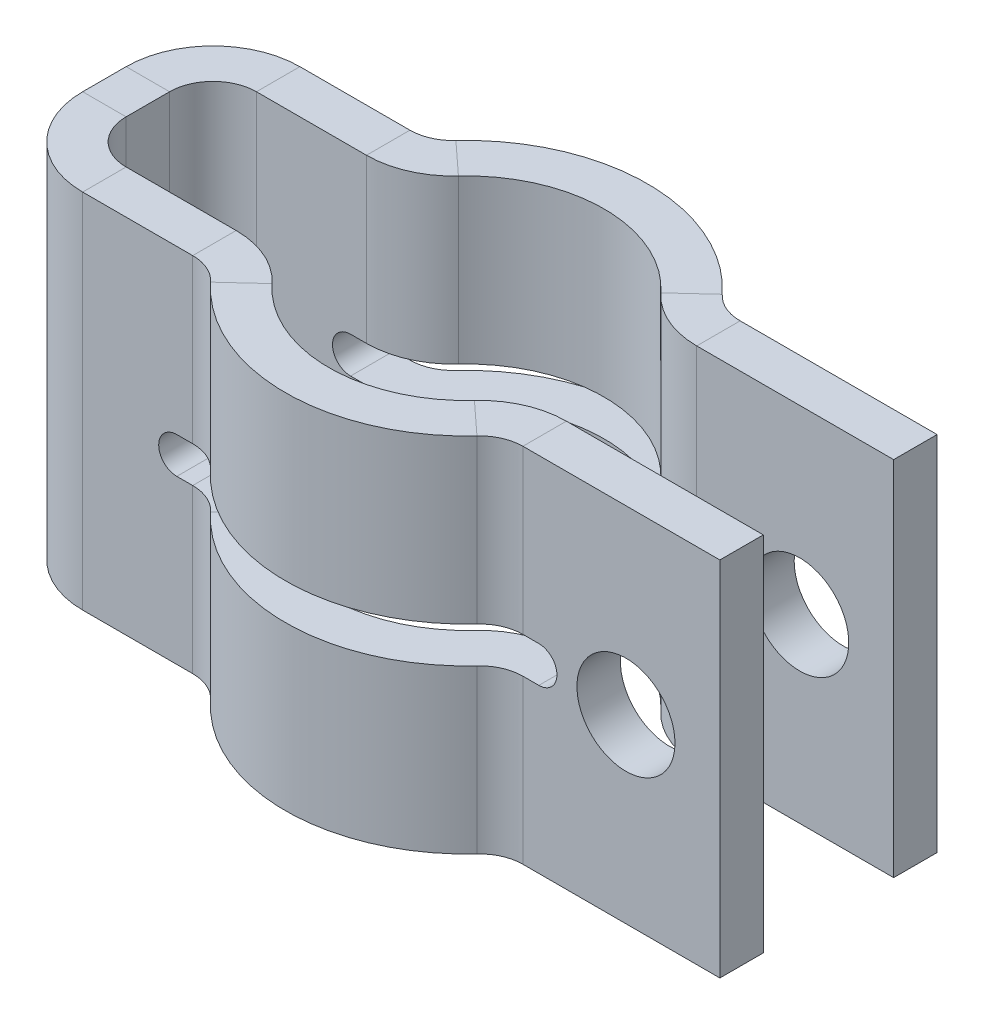
from build123d import *

# Parameters (mm, degrees)
BASE_FLANGE1_START      = -1.25
BASE_FLANGE1_DEPTH      = 2.5
SKETCH6_R               = 0.338529601
CUT_EXTRUDE1_DEPTH      = 4.436931771
CUT_EXTRUDE2_DEPTH      = 4.436931771
CUT_EXTRUDE2_DEPTH_BACK = 4.436931771


# Read off the part's stored shape, not the designer's step: Base-Flange1
with BuildPart() as part:
    # Base-Flange1 outline → Base-Flange1 (new body)
    with BuildSketch(Plane(origin=(0, 0, 0), x_dir=(1, 0, 0), z_dir=(0, 1, 0)).offset(BASE_FLANGE1_START)):
        with BuildLine():
            Line((1.140175425, 0.45), (2.5, 0.45))
            Line((2.5, 0.45), (2.5, 0.75))
            Line((2.5, 0.75), (1.140175425, 0.75))
            ThreePointArc((1.140175425, 0.75), (1.019692526, 0.775256718), (0.919496311, 0.846774194))
            ThreePointArc((0.919496311, 0.846774194), (0, 1.25), (-0.919496311, 0.846774194))
            ThreePointArc((-0.919496311, 0.846774194), (-1.019692526, 0.775256718), (-1.140175425, 0.75))
            Line((-1.140175425, 0.75), (-1.9, 0.75))
            ThreePointArc((-1.9, 0.75), (-2.324264069, 0.574264069), (-2.5, 0.15))
            Line((-2.5, 0.15), (-2.5, -0.15))
            ThreePointArc((-2.5, -0.15), (-2.324264069, -0.574264069), (-1.9, -0.75))
            Line((-1.9, -0.75), (-1.140175425, -0.75))
            ThreePointArc((-1.140175425, -0.75), (-1.019692526, -0.775256718), (-0.919496311, -0.846774194))
            ThreePointArc((-0.919496311, -0.846774194), (0, -1.25), (0.919496311, -0.846774194))
            ThreePointArc((0.919496311, -0.846774194), (1.019692526, -0.775256718), (1.140175425, -0.75))
            Line((1.140175425, -0.75), (2.5, -0.75))
            Line((2.5, -0.75), (2.5, -0.45))
            Line((2.5, -0.45), (1.140175425, -0.45))
            ThreePointArc((1.140175425, -0.45), (0.899209626, -0.500513436), (0.698817196, -0.643548387))
            ThreePointArc((0.698817196, -0.643548387), (0, -0.95), (-0.698817196, -0.643548387))
            ThreePointArc((-0.698817196, -0.643548387), (-0.899209626, -0.500513436), (-1.140175425, -0.45))
            Line((-1.140175425, -0.45), (-1.9, -0.45))
            ThreePointArc((-1.9, -0.45), (-2.112132034, -0.362132034), (-2.2, -0.15))
            Line((-2.2, -0.15), (-2.2, 0.15))
            ThreePointArc((-2.2, 0.15), (-2.112132034, 0.362132034), (-1.9, 0.45))
            Line((-1.9, 0.45), (-1.140175425, 0.45))
            ThreePointArc((-1.140175425, 0.45), (-0.899209626, 0.500513436), (-0.698817196, 0.643548387))
            ThreePointArc((-0.698817196, 0.643548387), (0, 0.95), (0.698817196, 0.643548387))
            ThreePointArc((0.698817196, 0.643548387), (0.899209626, 0.500513436), (1.140175425, 0.45))
        make_face()
    extrude(amount=BASE_FLANGE1_DEPTH)

    # Sketch6 → Cut-Extrude1 (cut, through all)
    with BuildSketch(Plane(origin=(0, 0, -0.75), x_dir=(-1, 0, 0), z_dir=(0, 0, -1))):
        with Locations(Location((-1.851561926, 0, 0), (0, 0, 180))):
            Circle(SKETCH6_R)
    extrude(amount=-CUT_EXTRUDE1_DEPTH, mode=Mode.SUBTRACT)

    # Sketch7 → Cut-Extrude2 (cut, two sides: drawn at the far end of the back side and taken through both)
    with BuildSketch(Plane.XY.offset(0.75).offset(-CUT_EXTRUDE2_DEPTH_BACK)):
        with BuildLine():
            Line((1.25, -0.125), (-1.25, -0.125))
            ThreePointArc((-1.25, -0.125), (-1.375, 0), (-1.25, 0.125))
            Line((-1.25, 0.125), (1.25, 0.125))
            ThreePointArc((1.25, 0.125), (1.375, 0), (1.25, -0.125))
        make_face()
    extrude(amount=CUT_EXTRUDE2_DEPTH + CUT_EXTRUDE2_DEPTH_BACK, mode=Mode.SUBTRACT)


solid = part.part
